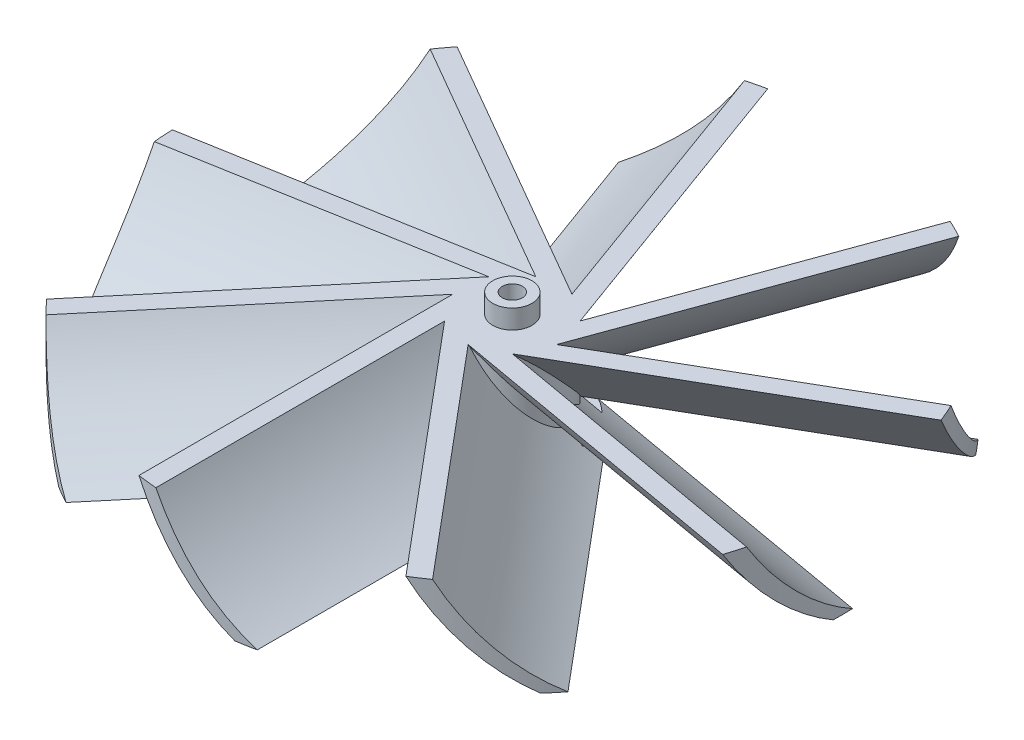
from build123d import *

# Parameters (mm, degrees)
BOSS_EXTRUDE1_DEPTH      = 5
BOSS_EXTRUDE1_DEPTH_BACK = 5
SKETCH1_R                = 5
BOSS_EXTRUDE2_DEPTH      = 45
CIRPATTERN1_COUNT        = 9
SKETCH4_R                = 134.5
SKETCH4_R_2              = 34.5
CUT_EXTRUDE1_DEPTH       = 45
CUT_EXTRUDE2_DEPTH       = 5
SKETCH6_R                = 6.634774001
SKETCH6_R_2              = 5
BOSS_EXTRUDE3_DEPTH      = 1
SKETCH7_R                = 2.05
SKETCH7_R_2              = 1.05
BOSS_EXTRUDE4_DEPTH      = 2
CUT_EXTRUDE3_START       = -2
SKETCH8_R                = 1.05
CUT_EXTRUDE3_DEPTH       = 2


with BuildPart() as part:
    # Sketch1 → Boss-Extrude1 (new, two sides: drawn at the far end of the back side and taken through both)
    with BuildSketch(Plane(origin=(0, 0, 0), x_dir=(1, 0, 0), z_dir=(0, 1, 0)).offset(-BOSS_EXTRUDE1_DEPTH_BACK)):
        Circle(SKETCH1_R)
    extrude(amount=BOSS_EXTRUDE1_DEPTH + BOSS_EXTRUDE1_DEPTH_BACK)

    # Sketch2 → Boss-Extrude2 (add)
    with BuildSketch(Plane.XY):
        with BuildLine():
            Line((-4.917468245, 5), (-2.917468245, 5))
            ThreePointArc((-2.917468245, 5), (1.424269267, -0.658262488), (7.082531755, -5))
            Line((7.082531755, -5), (5.082531755, -5))
            ThreePointArc((5.082531755, -5), (-0.575730733, -0.658262488), (-4.917468245, 5))
        make_face()
    boss_extrude2 = extrude(amount=BOSS_EXTRUDE2_DEPTH)

    # CirPattern1: Boss-Extrude2 ×9 about axis
    cirpattern1_axis = Axis((0, 0, 0), (0, 1, 0))
    for i in range(1, CIRPATTERN1_COUNT):
        add(boss_extrude2.rotate(cirpattern1_axis, i * 360 / CIRPATTERN1_COUNT))

    # Sketch4 → Cut-Extrude1 (cut)
    with BuildSketch(Plane(origin=(0, 5, 0), x_dir=(1, 0, 0), z_dir=(0, 1, 0))):
        Circle(SKETCH4_R)
        Circle(SKETCH4_R_2, mode=Mode.SUBTRACT)
    extrude(amount=-CUT_EXTRUDE1_DEPTH, mode=Mode.SUBTRACT)

    # Sketch5 → Cut-Extrude2 (cut)
    with BuildSketch(Plane.XZ.offset(5)):
        with BuildLine():
            Line((-0.6875, -1.094486181), (-0.6875, 1.094486181))
            ThreePointArc((-0.6875, 1.094486181), (1.2925, 0), (-0.6875, -1.094486181))
        make_face()
    extrude(amount=-CUT_EXTRUDE2_DEPTH, mode=Mode.SUBTRACT)

    # Sketch6 → Boss-Extrude3 (add)
    with BuildSketch(Plane.XZ.offset(5)):
        Circle(SKETCH6_R)
        Circle(SKETCH6_R_2, mode=Mode.SUBTRACT)
    extrude(amount=-BOSS_EXTRUDE3_DEPTH)

    # Sketch7 → Boss-Extrude4 (add)
    with BuildSketch(Plane(origin=(0, 5, 0), x_dir=(1, 0, 0), z_dir=(0, 1, 0))):
        Circle(SKETCH7_R)
        Circle(SKETCH7_R_2, mode=Mode.SUBTRACT)
    extrude(amount=BOSS_EXTRUDE4_DEPTH)

    # Sketch8 → Cut-Extrude3 (cut)
    with BuildSketch(Plane(origin=(0, 5, 0), x_dir=(1, 0, 0), z_dir=(0, 1, 0)).offset(CUT_EXTRUDE3_START)):
        Circle(SKETCH8_R)
    extrude(amount=CUT_EXTRUDE3_DEPTH, mode=Mode.SUBTRACT)


solid = part.part
